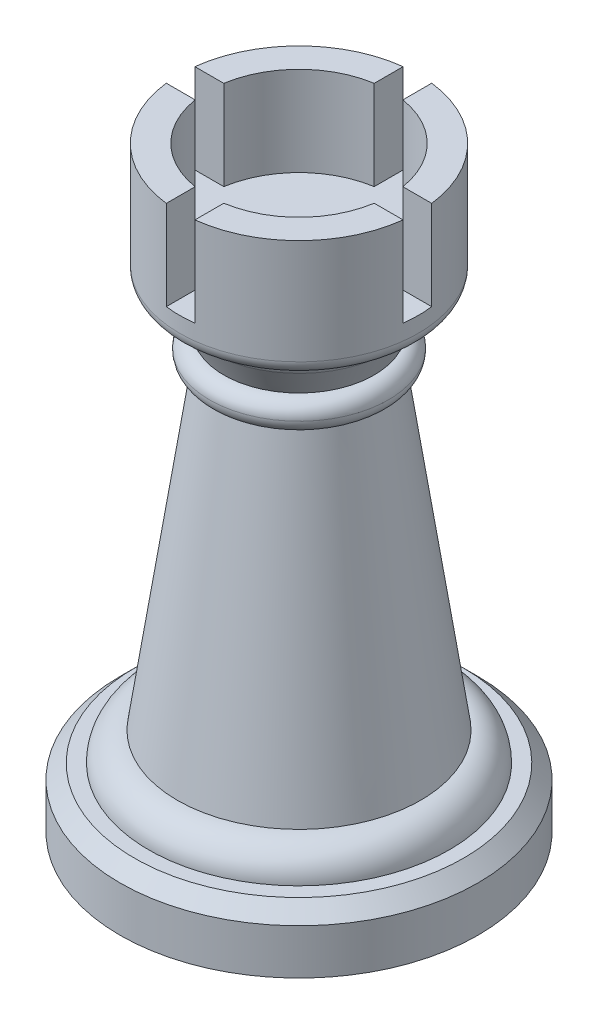
from build123d import *

# Parameters (mm, degrees)
CHAMFER1_SIZE      = 0.762
FILLET1_R          = 1.524
FILLET3_R          = 0.762
SKETCH3_W          = 1.524
SKETCH3_H          = 1.524
CUT_EXTRUDE1_DEPTH = 4.7625


with BuildPart() as part:
    # Sketch1 → Revolve1 (revolve)
    with BuildSketch(Plane.XY, mode=Mode.PRIVATE) as revolve1_sk:
        Polygon((0, 0), (-9.525, 0), (-9.525, 3.175), (-8.001, 3.175), (-8.001, 4.699), (-6.477, 4.699), (-4.0386, 21.5392), (-4.7625, 21.5392), (-4.7625, 23.0632), (-4.0005, 23.0632), (-4.826, 24.638), (-4.826, 25.4), (-6.35, 25.4), (-6.35, 31.75), (0, 31.75), align=None)
    revolve(revolve1_sk.sketch.rotate(Axis((0, 0, 0), (0, 1, 0)), 270), axis=Axis((0, 0, 0), (0, 1, 0)))

    # Chamfer1
    chamfer1_edges = [part.edges().sort_by_distance(p)[0] for p in [
        (0, 3.175, 9.525),
    ]]
    chamfer(chamfer1_edges, length=CHAMFER1_SIZE)

    # Fillet1
    fillet1_edges = [part.edges().sort_by_distance(p)[0] for p in [
        (0, 4.699, 8.001),
    ]]
    fillet(fillet1_edges, radius=FILLET1_R - 0.0001)  # a hair under: the kernel refuses the full size

    # Fillet2: read off the stored shape, not the designer's step
    # Fillet2 outline → Fillet2 (revolve, cut)
    with BuildSketch(Plane.XY):
        with BuildLine():
            ThreePointArc((6.35, 26.162), (6.126815367, 25.623184633), (5.588, 25.4))
            Line((5.588, 25.4), (6.35, 25.4))
            Line((6.35, 25.4), (6.35, 26.162))
        make_face()
        with BuildLine():
            Line((4.7625, 22.3012), (4.7625, 23.0632))
            Line((4.7625, 23.0632), (4.0005, 23.0632))
            ThreePointArc((4.0005, 23.0632), (4.539315367, 22.840015367), (4.7625, 22.3012))
        make_face()
        with BuildLine():
            Line((4.7625, 21.5392), (4.7625, 22.300246904))
            ThreePointArc((4.7625, 22.300246904), (4.552621454, 21.775074646), (4.0386, 21.5392))
            Line((4.0386, 21.5392), (4.7625, 21.5392))
        make_face()
    revolve(axis=Axis((0, 0, 0), (0, 1, 0)), mode=Mode.SUBTRACT)

    # Fillet2 2 outline → Fillet2 2 (revolve)
    with BuildSketch(Plane.XY):
        with BuildLine():
            ThreePointArc((4.826, 24.638), (5.049184633, 25.176815367), (5.588, 25.4))
            Line((5.588, 25.4), (4.826, 25.4))
            Line((4.826, 25.4), (4.826, 24.638))
        make_face()
    revolve(axis=Axis((0, 0, 0), (0, 1, 0)))

    # Fillet3
    fillet3_edges = [part.edges().sort_by_distance(p)[0] for p in [
        (-3.412497326, 24.638, 3.412497326),
    ]]
    fillet(fillet3_edges, radius=FILLET3_R)

    # Sketch3 → Cut-Extrude1 (cut)
    with BuildSketch(Plane(origin=(0, 31.75, 0), x_dir=(1, 0, 0), z_dir=(0, 1, 0))):
        with BuildLine():
            ThreePointArc((-0.762, 4.765462412), (-3.412497326, 3.412497326), (-4.765462412, 0.762))
            Line((-4.765462412, 0.762), (-0.762, 0.762))
            Line((-0.762, 0.762), (-0.762, 4.765462412))
        make_face()
        with BuildLine():
            ThreePointArc((-4.765462412, 0.762), (-4.826, 0), (-4.765462412, -0.762))
            Line((-4.765462412, -0.762), (-0.762, -0.762))
            Line((-0.762, -0.762), (-0.762, 0.762))
            Line((-0.762, 0.762), (-4.765462412, 0.762))
        make_face()
        with BuildLine():
            Line((-0.762, -0.762), (-4.765462412, -0.762))
            ThreePointArc((-4.765462412, -0.762), (-3.412497326, -3.412497326), (-0.762, -4.765462412))
            Line((-0.762, -4.765462412), (-0.762, -0.762))
        make_face()
        with BuildLine():
            Line((4.765462412, -0.762), (0.762, -0.762))
            Line((0.762, -0.762), (0.762, -4.765462412))
            ThreePointArc((0.762, -4.765462412), (3.412497326, -3.412497326), (4.765462412, -0.762))
        make_face()
        with BuildLine():
            Line((0.762, -0.762), (-0.762, -0.762))
            Line((-0.762, -0.762), (-0.762, -4.765462412))
            ThreePointArc((-0.762, -4.765462412), (0, -4.826), (0.762, -4.765462412))
            Line((0.762, -4.765462412), (0.762, -0.762))
        make_face()
        Rectangle(SKETCH3_W, SKETCH3_H)
        with BuildLine():
            Line((-0.762, 4.765462412), (-0.762, 0.762))
            Line((-0.762, 0.762), (0.762, 0.762))
            Line((0.762, 0.762), (0.762, 4.765462412))
            ThreePointArc((0.762, 4.765462412), (0, 4.826), (-0.762, 4.765462412))
        make_face()
        with BuildLine():
            Line((0.762, 4.765462412), (0.762, 0.762))
            Line((0.762, 0.762), (4.765462412, 0.762))
            ThreePointArc((4.765462412, 0.762), (3.412497326, 3.412497326), (0.762, 4.765462412))
        make_face()
        with BuildLine():
            Line((0.762, 0.762), (0.762, -0.762))
            Line((0.762, -0.762), (4.765462412, -0.762))
            ThreePointArc((4.765462412, -0.762), (4.810841797, -0.382200471), (4.826, 0))
            ThreePointArc((4.826, 0), (4.810841797, 0.382200471), (4.765462412, 0.762))
            Line((4.765462412, 0.762), (0.762, 0.762))
        make_face()
        with BuildLine():
            Line((-0.762, -4.765462412), (-0.762, -6.304114212))
            ThreePointArc((-0.762, -6.304114212), (0, -6.35), (0.762, -6.304114212))
            Line((0.762, -6.304114212), (0.762, -4.765462412))
            ThreePointArc((0.762, -4.765462412), (0, -4.826), (-0.762, -4.765462412))
        make_face()
        with BuildLine():
            ThreePointArc((0.762, 6.304114212), (0, 6.35), (-0.762, 6.304114212))
            Line((-0.762, 6.304114212), (-0.762, 4.765462412))
            ThreePointArc((-0.762, 4.765462412), (0, 4.826), (0.762, 4.765462412))
            Line((0.762, 4.765462412), (0.762, 6.304114212))
        make_face()
        with BuildLine():
            ThreePointArc((-6.304114212, 0.762), (-6.35, 0), (-6.304114212, -0.762))
            Line((-6.304114212, -0.762), (-4.765462412, -0.762))
            ThreePointArc((-4.765462412, -0.762), (-4.826, 0), (-4.765462412, 0.762))
            Line((-4.765462412, 0.762), (-6.304114212, 0.762))
        make_face()
        with BuildLine():
            Line((4.765462412, -0.762), (6.304114212, -0.762))
            ThreePointArc((6.304114212, -0.762), (6.338518173, -0.381690158), (6.35, 0))
            ThreePointArc((6.35, 0), (6.338518173, 0.381690158), (6.304114212, 0.762))
            Line((6.304114212, 0.762), (4.765462412, 0.762))
            ThreePointArc((4.765462412, 0.762), (4.810841797, 0.382200471), (4.826, 0))
            ThreePointArc((4.826, 0), (4.810841797, -0.382200471), (4.765462412, -0.762))
        make_face()
    extrude(amount=-CUT_EXTRUDE1_DEPTH, mode=Mode.SUBTRACT)


solid = part.part
